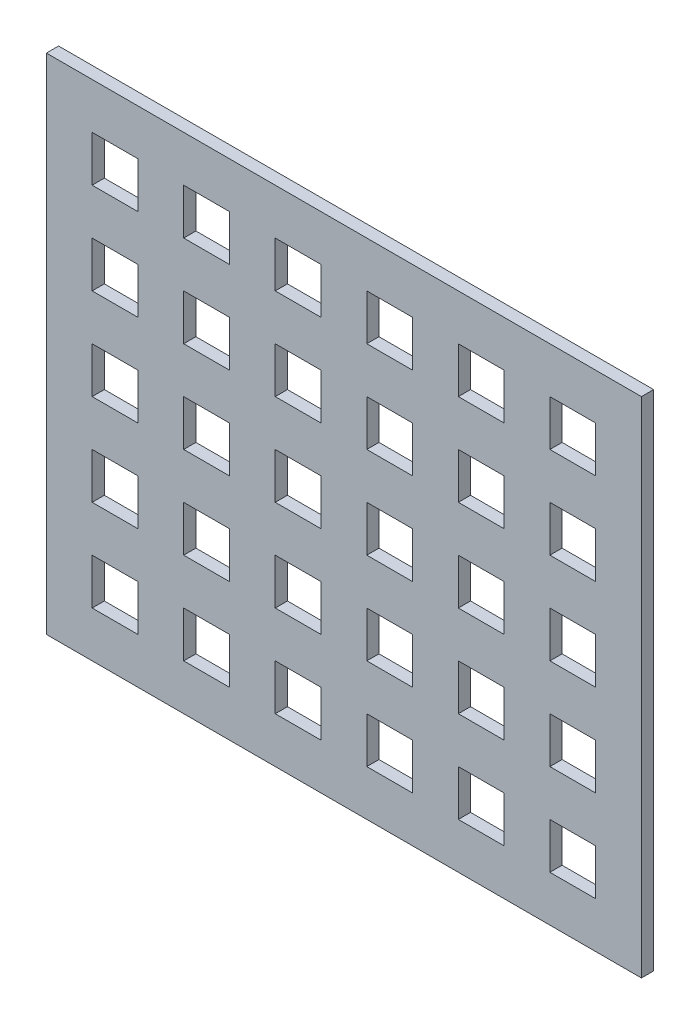
from build123d import *

# Parameters (mm, degrees)
SKETCH_1_W             = 18
SKETCH_1_H             = 1.5
EXTRUDE_1_DEPTH        = 0.4
PATTERN_LINEAR_1_COUNT = 6
PATTERN_LINEAR_1_PITCH = 3
EXTRUDE_3_DEPTH        = 0.4
PATTERN_LINEAR_2_COUNT = 7
PATTERN_LINEAR_2_PITCH = 3


with BuildPart() as part:
    # 草图1 → 凸台-拉伸1 (new body)
    with BuildSketch(Plane.XY):
        with Locations((9, 0.75)):
            Rectangle(SKETCH_1_W, SKETCH_1_H)
    extrude(amount=EXTRUDE_1_DEPTH)


with BuildPart() as pattern_linear_1_1:
    # 阵列(线性)1: pattern copy
    add(part.part.moved(Location(Vector(0, 1, 0) * (1 * PATTERN_LINEAR_1_PITCH))))


with BuildPart() as pattern_linear_1_2:
    # 阵列(线性)1: pattern copy
    add(part.part.moved(Location(Vector(0, 1, 0) * (2 * PATTERN_LINEAR_1_PITCH))))


with BuildPart() as pattern_linear_1_3:
    # 阵列(线性)1: pattern copy
    add(part.part.moved(Location(Vector(0, 1, 0) * (3 * PATTERN_LINEAR_1_PITCH))))


with BuildPart() as pattern_linear_1_4:
    # 阵列(线性)1: pattern copy
    add(part.part.moved(Location(Vector(0, 1, 0) * (4 * PATTERN_LINEAR_1_PITCH))))


with BuildPart() as pattern_linear_1_5:
    # 阵列(线性)1: pattern copy
    add(part.part.moved(Location(Vector(0, 1, 0) * (5 * PATTERN_LINEAR_1_PITCH))))


with BuildPart() as part_1:
    add(part.part)

    add(pattern_linear_1_1.part)  # 凸台-拉伸3 merges 阵列(线性)1_1

    add(pattern_linear_1_2.part)  # 凸台-拉伸3 merges 阵列(线性)1_2

    add(pattern_linear_1_3.part)  # 凸台-拉伸3 merges 阵列(线性)1_3
    # 草图3 → 凸台-拉伸3 (add)
    with BuildSketch(Plane.XY.offset(0.4)):
        Polygon((0, 16.5), (0, 10.5), (0, 0), (-1.5, 0), (-1.5, 10.98507125), (-1.5, 16.5), align=None)
    extrude_3 = extrude(amount=-EXTRUDE_3_DEPTH)

    # 阵列(线性)2: 凸台-拉伸3 ×7
    with Locations(*[(i * PATTERN_LINEAR_2_PITCH, 0, 0) for i in range(1, PATTERN_LINEAR_2_COUNT)]):
        add(extrude_3)

    # Combine 1: read off the stored shape, not the designer's step
    # Combine 1: union 阵列(线性)1_4, 阵列(线性)1_5
    add(pattern_linear_1_4.part)
    add(pattern_linear_1_5.part)


solid = part_1.part
